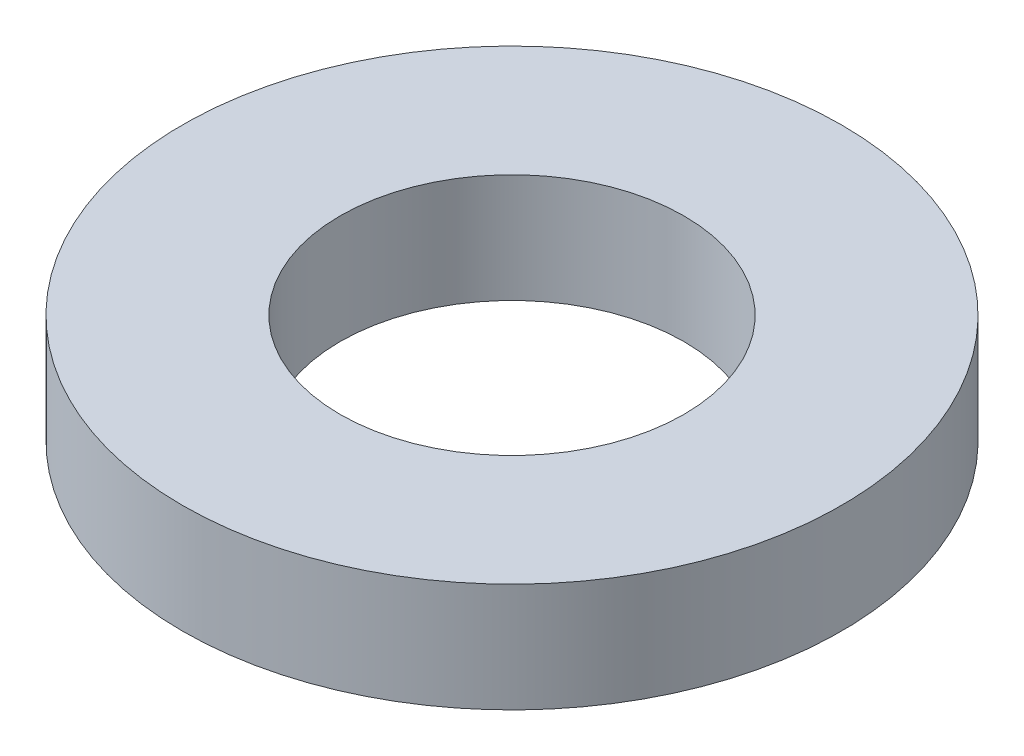
from build123d import *

# Parameters (mm, degrees)
SKETCH1_R           = 57.5
BOSS_EXTRUDE1_DEPTH = 19
SKETCH2_R           = 30
CUT_EXTRUDE1_DEPTH  = 84.507484694


with BuildPart() as part:
    # Sketch1 → Boss-Extrude1 (new body)
    with BuildSketch(Plane(origin=(0, 0, 0), x_dir=(1, 0, 0), z_dir=(0, 1, 0))):
        Circle(SKETCH1_R)
    extrude(amount=BOSS_EXTRUDE1_DEPTH)

    # Sketch2 → Cut-Extrude1 (cut, through all)
    with BuildSketch(Plane(origin=(0, 0, 0), x_dir=(1, 0, 0), z_dir=(0, 1, 0))):
        Circle(SKETCH2_R)
    extrude(amount=CUT_EXTRUDE1_DEPTH, mode=Mode.SUBTRACT)


solid = part.part
